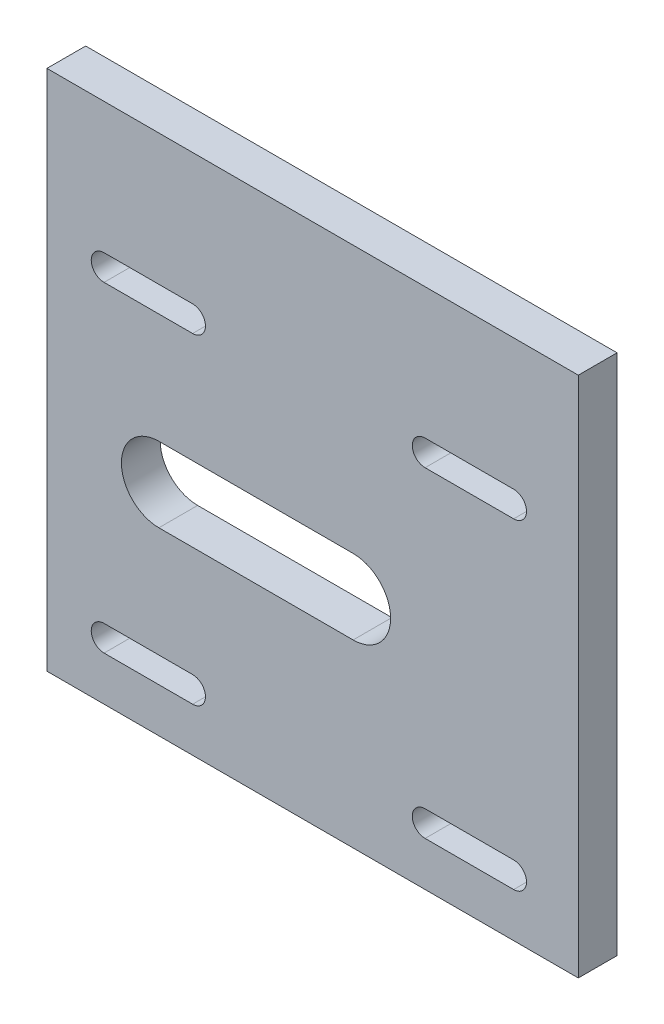
from build123d import *

# Parameters (mm, degrees)
SKETCH1_W           = 152.4
SKETCH1_H           = 149.733
BOSS_EXTRUDE1_DEPTH = 11.1125


with BuildPart() as part:
    # Sketch1 → Boss-Extrude1 (new body)
    with BuildSketch(Plane.XY):
        with Locations((-208.357186737, -43.420313263)):
            Rectangle(SKETCH1_W, SKETCH1_H)
        with BuildLine():
            Line((-242.774186737, -105.586813263), (-268.174186737, -105.586813263))
            ThreePointArc((-268.174186737, -105.586813263), (-271.857186737, -101.903813263), (-268.174186737, -98.220813263))
            Line((-268.174186737, -98.220813263), (-242.774186737, -98.220813263))
            ThreePointArc((-242.774186737, -98.220813263), (-239.091186737, -101.903813263), (-242.774186737, -105.586813263))
        make_face(mode=Mode.SUBTRACT)
        with BuildLine():
            Line((-242.774186737, -13.511813263), (-268.174186737, -13.511813263))
            ThreePointArc((-268.174186737, -13.511813263), (-271.857186737, -9.828813263), (-268.174186737, -6.145813263))
            Line((-268.174186737, -6.145813263), (-242.774186737, -6.145813263))
            ThreePointArc((-242.774186737, -6.145813263), (-239.091186737, -9.828813263), (-242.774186737, -13.511813263))
        make_face(mode=Mode.SUBTRACT)
        with BuildLine():
            Line((-150.699186737, -13.511813263), (-176.099186737, -13.511813263))
            ThreePointArc((-176.099186737, -13.511813263), (-179.782186737, -9.828813263), (-176.099186737, -6.145813263))
            Line((-176.099186737, -6.145813263), (-150.699186737, -6.145813263))
            ThreePointArc((-150.699186737, -6.145813263), (-147.016186737, -9.828813263), (-150.699186737, -13.511813263))
        make_face(mode=Mode.SUBTRACT)
        with BuildLine():
            Line((-150.699186737, -105.586813263), (-176.099186737, -105.586813263))
            ThreePointArc((-176.099186737, -105.586813263), (-179.782186737, -101.903813263), (-176.099186737, -98.220813263))
            Line((-176.099186737, -98.220813263), (-150.699186737, -98.220813263))
            ThreePointArc((-150.699186737, -98.220813263), (-147.016186737, -101.903813263), (-150.699186737, -105.586813263))
        make_face(mode=Mode.SUBTRACT)
        with BuildLine():
            Line((-196.736686737, -66.610669433), (-252.452295744, -66.610669433))
            ThreePointArc((-252.452295744, -66.610669433), (-263.196651914, -55.866313263), (-252.452295744, -45.121957093))
            Line((-252.452295744, -45.121957093), (-196.736686737, -45.121957093))
            ThreePointArc((-196.736686737, -45.121957093), (-185.992330568, -55.866313263), (-196.736686737, -66.610669433))
        make_face(mode=Mode.SUBTRACT)
    extrude(amount=BOSS_EXTRUDE1_DEPTH)


solid = part.part
